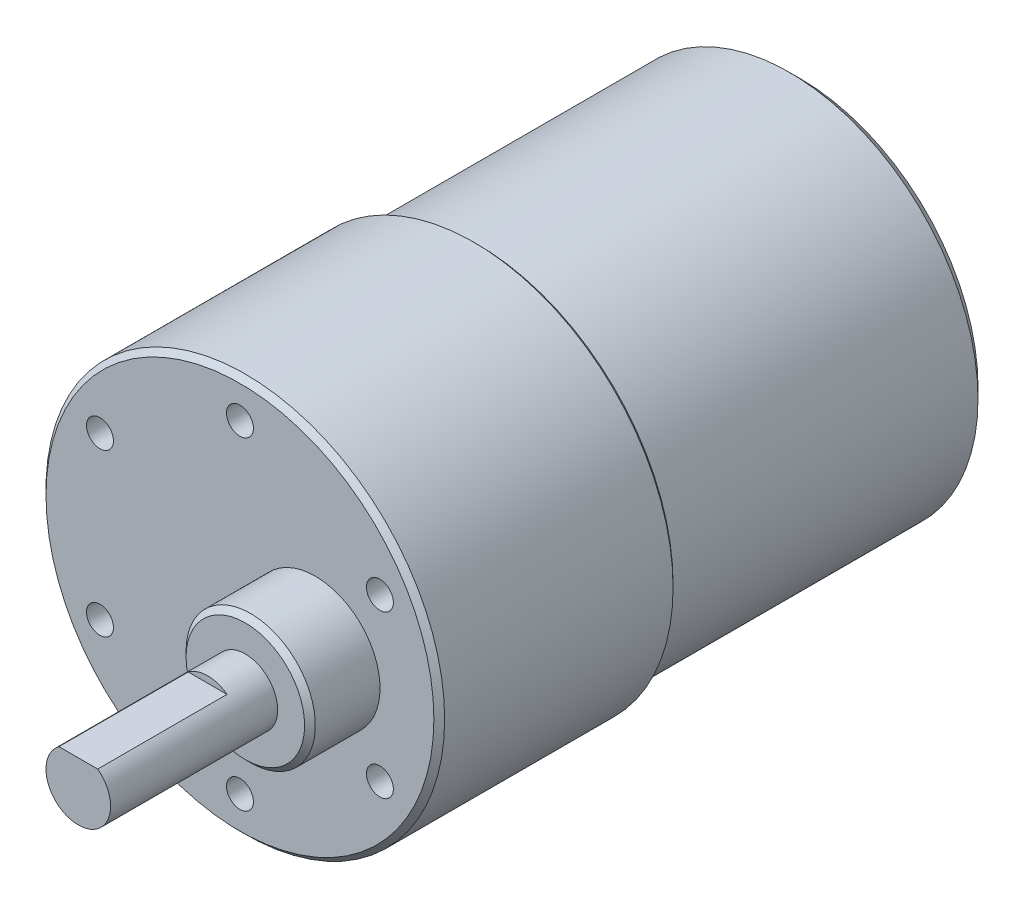
from build123d import *

# Parameters (mm, degrees)
SKETCH2_R                 = 17.5
BOSS_EXTRUDE1_DEPTH       = 30
SKETCH3_R                 = 18.5
BOSS_EXTRUDE2_DEPTH       = 22
M3X0_5_TAPPED_HOLE1_D     = 2.5
M3X0_5_TAPPED_HOLE1_DEPTH = 7.5
M3X0_5_TAPPED_HOLE1_TIP   = 0.751075774
SKETCH6_R                 = 6
BOSS_EXTRUDE3_DEPTH       = 6.5
SKETCH8_R                 = 3
BOSS_EXTRUDE4_DEPTH       = 3.5
BOSS_EXTRUDE5_DEPTH       = 12
CHAMFER1_SIZE             = 0.5
CHAMFER2_SIZE             = 0.5
CHAMFER3_SIZE             = 0.3
CHAMFER4_SIZE             = 1


with BuildPart() as part:
    # Sketch2 → Boss-Extrude1 (new body)
    with BuildSketch(Plane.XY):
        Circle(SKETCH2_R)
    extrude(amount=BOSS_EXTRUDE1_DEPTH)

    # Sketch3 → Boss-Extrude2 (add)
    with BuildSketch(Plane.XY.offset(30)):
        Circle(SKETCH3_R)
    extrude(amount=BOSS_EXTRUDE2_DEPTH)

    # M3x0.5 Tapped Hole1
    with Locations(Plane.XY.offset(52)):
        with Locations((12.990381057, -7.5), (12.990381057, 7.5), (0, 15), (-12.990381057, 7.5), (-12.990381057, -7.5), (0, -15)):
            Hole(M3X0_5_TAPPED_HOLE1_D / 2, depth=M3X0_5_TAPPED_HOLE1_DEPTH)
            with Locations((0, 0, -(M3X0_5_TAPPED_HOLE1_DEPTH + M3X0_5_TAPPED_HOLE1_TIP / 2))):  # 118° drill point
                Cone(0, M3X0_5_TAPPED_HOLE1_D / 2, M3X0_5_TAPPED_HOLE1_TIP, mode=Mode.SUBTRACT)

    # Sketch6 → Boss-Extrude3 (add)
    with BuildSketch(Plane.XY.offset(52)):
        with Locations((7, 0)):
            Circle(SKETCH6_R)
    extrude(amount=BOSS_EXTRUDE3_DEPTH)

    # Sketch8 → Boss-Extrude4 (add)
    with BuildSketch(Plane.XY.offset(58.5)):
        with Locations((7, 0)):
            Circle(SKETCH8_R)
    extrude(amount=BOSS_EXTRUDE4_DEPTH)

    # Sketch9 → Boss-Extrude5 (add)
    with BuildSketch(Plane.XY.offset(62)):
        with BuildLine():
            Line((8.8, 2.4), (5.2, 2.4))
            ThreePointArc((5.2, 2.4), (5.658359214, -2.683281573), (10, 0))
            ThreePointArc((10, 0), (9.683281573, 1.341640786), (8.8, 2.4))
        make_face()
    extrude(amount=BOSS_EXTRUDE5_DEPTH)

    # Chamfer1
    chamfer1_edges = [part.edges().sort_by_distance(p)[0] for p in [
        (-18.5, 0, 52),
    ]]
    chamfer(chamfer1_edges, length=CHAMFER1_SIZE)

    # Chamfer2
    chamfer2_edges = [part.edges().sort_by_distance(p)[0] for p in [
        (1, 0, 58.5),
    ]]
    chamfer(chamfer2_edges, length=CHAMFER2_SIZE)

    # Chamfer3
    chamfer3_edges = [part.edges().sort_by_distance(p)[0] for p in [
        (-18.5, 0, 30),
    ]]
    chamfer(chamfer3_edges, length=CHAMFER3_SIZE)

    # Chamfer4
    chamfer4_edges = [part.edges().sort_by_distance(p)[0] for p in [
        (-17.5, 0, 0),
    ]]
    chamfer(chamfer4_edges, length=CHAMFER4_SIZE)


solid = part.part
